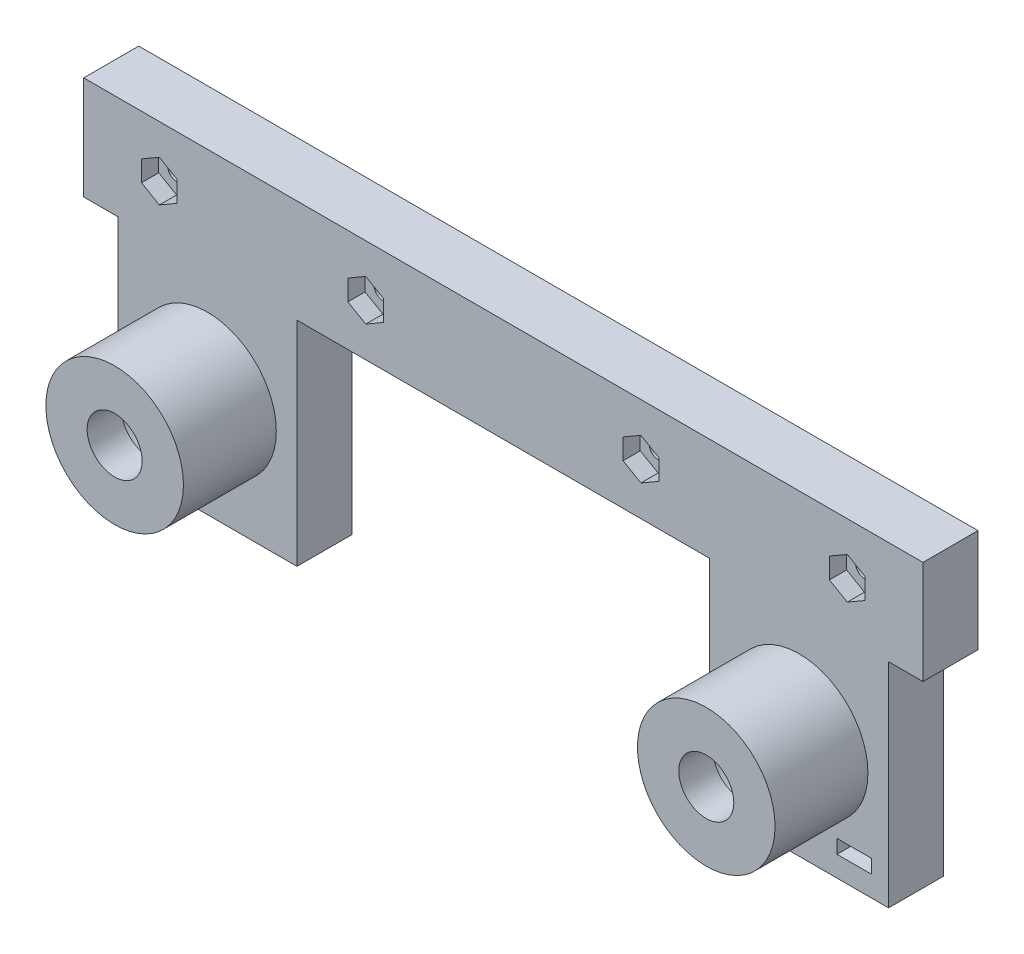
from build123d import *

# Parameters (mm, degrees)
SKETCH1_W               = 122
SKETCH1_H               = 15
BOSS_EXTRUDE1_DEPTH     = 8
CUT_EXTRUDE1_DEPTH      = 62.977818613
CUT_EXTRUDE1_DEPTH_BACK = 62.977818613
SKETCH2_R               = 1.3
CUT_EXTRUDE3_DEPTH      = 2.5
SKETCH5_W               = 26
SKETCH5_H               = 31
SKETCH5_R               = 7.5
BOSS_EXTRUDE2_DEPTH     = 8
SKETCH6_R               = 10
SKETCH6_R_2             = 7.5
BOSS_EXTRUDE3_DEPTH     = 8.5
SKETCH7_R               = 10
SKETCH7_R_2             = 4
BOSS_EXTRUDE4_DEPTH     = 5
SKETCH8_R               = 1.3
CUT_EXTRUDE4_DEPTH      = 5
CUT_EXTRUDE5_DEPTH      = 74.385965961
CUT_EXTRUDE5_DEPTH_BACK = 74.385965961
SKETCH9_W               = 5
SKETCH9_H               = 2


with BuildPart() as part:
    # Sketch1 → Boss-Extrude1 (new body)
    with BuildSketch(Plane.XY):
        Rectangle(SKETCH1_W, SKETCH1_H)
    extrude(amount=BOSS_EXTRUDE1_DEPTH)

    # Sketch2 → Cut-Extrude1 (cut, two sides: drawn at the far end of the back side and taken through both)
    with BuildSketch(Plane.XY.offset(8).offset(-CUT_EXTRUDE1_DEPTH_BACK)):
        with Locations((-20, 0)):
            Circle(SKETCH2_R)
        with Locations((20, 0)):
            Circle(SKETCH2_R)
        with Locations((-50, 0)):
            Circle(SKETCH2_R)
        with Locations((50, 0)):
            Circle(SKETCH2_R)
    extrude(amount=CUT_EXTRUDE1_DEPTH + CUT_EXTRUDE1_DEPTH_BACK, mode=Mode.SUBTRACT)

    # Sketch4 → Cut-Extrude3 (cut)
    with BuildSketch(Plane.XY.offset(8)):
        Polygon((-50, 3), (-52.598076211, 1.5), (-52.598076211, -1.5), (-50, -3), (-47.401923789, -1.5), (-47.401923789, 1.5), align=None)
        Polygon((-20, 3), (-22.598076211, 1.5), (-22.598076211, -1.5), (-20, -3), (-17.401923789, -1.5), (-17.401923789, 1.5), align=None)
        Polygon((20, 3), (17.401923789, 1.5), (17.401923789, -1.5), (20, -3), (22.598076211, -1.5), (22.598076211, 1.5), align=None)
        Polygon((50, 3), (47.401923789, 1.5), (47.401923789, -1.5), (50, -3), (52.598076211, -1.5), (52.598076211, 1.5), align=None)
    extrude(amount=-CUT_EXTRUDE3_DEPTH, mode=Mode.SUBTRACT)

    # Sketch5 → Boss-Extrude2 (add)
    # profile 1 of 2: a face of its own
    with BuildSketch(Plane.XY):
        with Locations((-43, -23)):
            Rectangle(SKETCH5_W, SKETCH5_H)
        with Locations((-43, -23)):
            Circle(SKETCH5_R, mode=Mode.SUBTRACT)
    # profile 2 of 2: a face of its own
    with BuildSketch(Plane.XY):
        with Locations((43, -23)):
            Rectangle(SKETCH5_W, SKETCH5_H)
        with Locations((43, -23)):
            Circle(SKETCH5_R, mode=Mode.SUBTRACT)
    extrude(amount=BOSS_EXTRUDE2_DEPTH)

    # Sketch6 → Boss-Extrude3 (add)
    # profile 1 of 2: a face of its own
    with BuildSketch(Plane.XY.offset(8)):
        with Locations((-43, -23)):
            Circle(SKETCH6_R)
        with Locations((-43, -23)):
            Circle(SKETCH6_R_2, mode=Mode.SUBTRACT)
    # profile 2 of 2: a face of its own
    with BuildSketch(Plane.XY.offset(8)):
        with Locations((43, -23)):
            Circle(SKETCH6_R)
        with Locations((43, -23)):
            Circle(SKETCH6_R_2, mode=Mode.SUBTRACT)
    extrude(amount=BOSS_EXTRUDE3_DEPTH)

    # Sketch7 → Boss-Extrude4 (add)
    # profile 1 of 2: a face of its own
    with BuildSketch(Plane.XY.offset(16.5)):
        with Locations((-43, -23)):
            Circle(SKETCH7_R)
        with Locations((-43, -23)):
            Circle(SKETCH7_R_2, mode=Mode.SUBTRACT)
    # profile 2 of 2: a face of its own
    with BuildSketch(Plane.XY.offset(16.5)):
        with Locations((43, -23)):
            Circle(SKETCH7_R)
        with Locations((43, -23)):
            Circle(SKETCH7_R_2, mode=Mode.SUBTRACT)
    extrude(amount=BOSS_EXTRUDE4_DEPTH)

    # Sketch8 → Cut-Extrude4 (cut)
    with BuildSketch(Plane.XZ.offset(38.5)):
        with Locations((51, 4)):
            Circle(SKETCH8_R)
        with Locations((-51, 4)):
            Circle(SKETCH8_R)
    extrude(amount=-CUT_EXTRUDE4_DEPTH, mode=Mode.SUBTRACT)

    # Sketch9 → Cut-Extrude5 (cut, two sides: drawn at the far end of the back side and taken through both)
    with BuildSketch(Plane.XY.offset(8).offset(-CUT_EXTRUDE5_DEPTH_BACK)):
        with Locations((-51, -34.5)):
            Rectangle(SKETCH9_W, SKETCH9_H)
        with Locations((51, -34.5)):
            Rectangle(SKETCH9_W, SKETCH9_H)
    extrude(amount=CUT_EXTRUDE5_DEPTH + CUT_EXTRUDE5_DEPTH_BACK, mode=Mode.SUBTRACT)


solid = part.part
